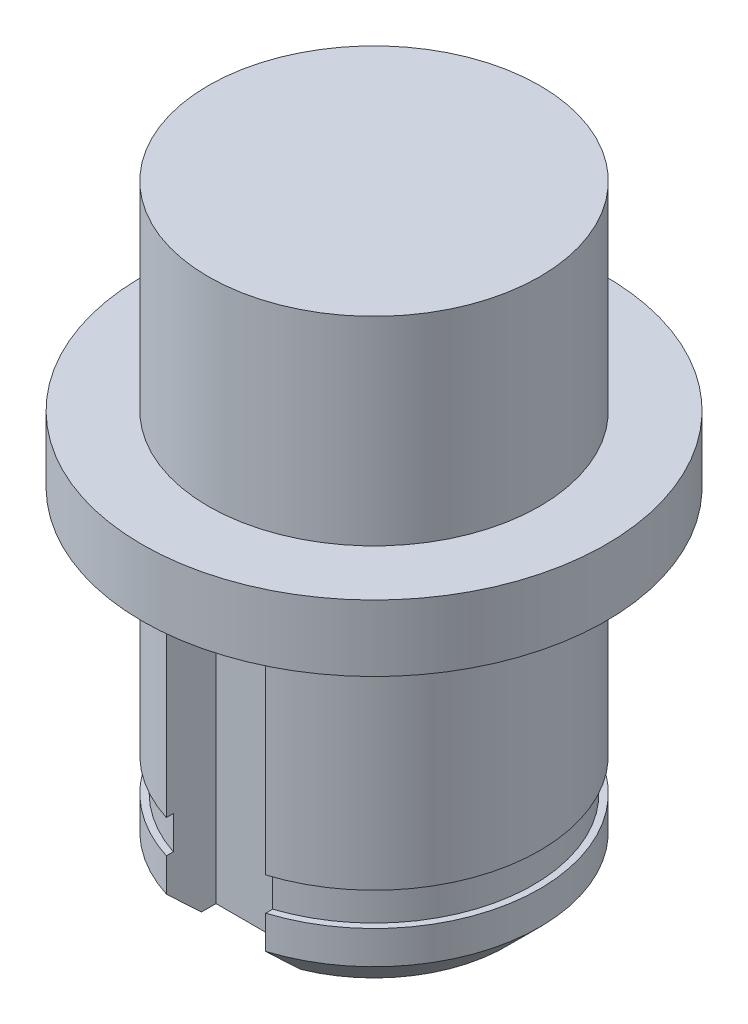
from build123d import *

# Parameters (mm, degrees)
SKETCH1_R               = 5
BOSS_EXTRUDE1_DEPTH     = 18
SKETCH2_W               = 2
SKETCH2_H               = 2
SKETCH2_5_W             = 0.2
SKETCH2_5_H             = 1
CUT_EXTRUDE1_DEPTH      = 21.542638584
CUT_EXTRUDE1_DEPTH_BACK = 10
CHAMFER2_SIZE           = 1


with BuildPart() as part:
    # Sketch1 → Boss-Extrude1 (new body)
    with BuildSketch(Plane(origin=(0, 0, 0), x_dir=(1, 0, 0), z_dir=(0, 1, 0))):
        Circle(SKETCH1_R)
    extrude(amount=BOSS_EXTRUDE1_DEPTH)

    # Sketch2 → Revolve1 (revolve)
    with BuildSketch(Plane(origin=(0, 0, 0), x_dir=(0, 0, -1), z_dir=(1, 0, 0))):
        with Locations((6, 11)):
            Rectangle(SKETCH2_W, SKETCH2_H)
    revolve(axis=Axis((0, 18, 0), (0, -1, 0)))

    # Sketch2<5> → Cut-Revolve1 (revolve, cut)
    with BuildSketch(Plane(origin=(0, 0, 0), x_dir=(0, 0, -1), z_dir=(1, 0, 0))):
        with Locations((4.9, 2.5)):
            Rectangle(SKETCH2_5_W, SKETCH2_5_H)
    revolve(axis=Axis((0, 18, 0), (0, -1, 0)), mode=Mode.SUBTRACT)

    # Sketch4 → Cut-Extrude1 (cut, two sides: drawn at the far end of the back side and taken through both)
    with BuildSketch(Plane.XZ.offset(-CUT_EXTRUDE1_DEPTH_BACK)):
        Polygon((-1.5, 43.805931583), (-1.5, 4.769696007), (-1.5, 3.269696007), (1.5, 3.269696007), (1.5, 4.769696007), (1.5, 43.805931583), (1.5, 121.878402734), (-1.5, 121.878402734), align=None)
    extrude(amount=CUT_EXTRUDE1_DEPTH + CUT_EXTRUDE1_DEPTH_BACK, mode=Mode.SUBTRACT)

    # Chamfer2
    chamfer2_edges = [part.edges().sort_by_distance(p)[0] for p in [
        (0, 0, -5),
    ]]
    chamfer(chamfer2_edges, length=CHAMFER2_SIZE)


solid = part.part
